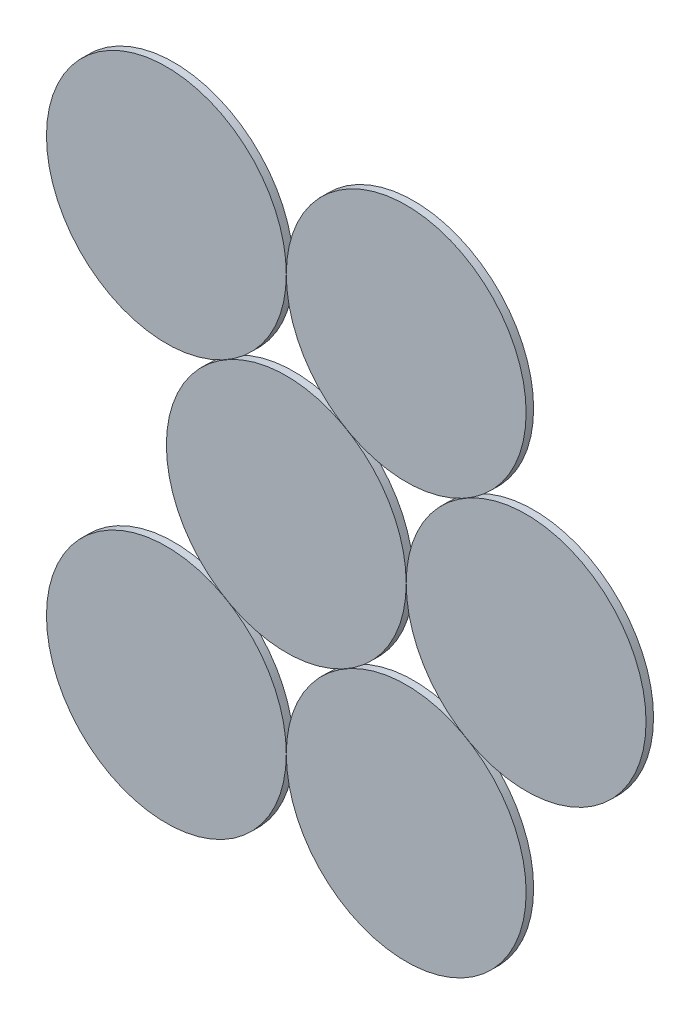
from build123d import *

# Parameters (mm, degrees)
SKETCH1_R           = 50.8
BOSS_EXTRUDE1_DEPTH = 3.175
FILL_PATTERN1_DEPTH = 3.175


# Read off the part's stored shape, not the designer's step: Fill Pattern1
with BuildPart() as part:
    # Sketch1 → Boss-Extrude1 (new body)
    with BuildSketch(Plane.XY):
        Circle(SKETCH1_R)
    extrude(amount=BOSS_EXTRUDE1_DEPTH)


with BuildPart() as body_2:
    # Fill Pattern1 outline → Fill Pattern1 (new body)
    with BuildSketch(Plane.XY):
        with BuildLine():
            ThreePointArc((127.000000809, -131.982272003), (203.2, -87.988180558), (127.000000001, -43.994090511))
            ThreePointArc((127.000000001, -43.994090511), (108.405909488, -62.588181024), (101.6, -87.988181024))
            ThreePointArc((101.6, -87.988181024), (108.405909721, -113.388181428), (127.000000809, -131.982272003))
        make_face()
        with BuildLine():
            ThreePointArc((76.2, -43.994090512), (101.6, -50.8), (127.000000001, -43.994090512))
            ThreePointArc((127.000000001, -43.994090512), (101.6, 50.8), (76.2, -43.994090512))
        make_face()
        with BuildLine():
            ThreePointArc((50.8, -175.976362049), (126.999999596, -219.970452795), (127.000000809, -131.982272004))
            ThreePointArc((127.000000809, -131.982272004), (101.600000016, -125.176362049), (76.19999922, -131.982271987))
            ThreePointArc((76.19999922, -131.982271987), (57.605909262, -150.576362439), (50.8, -175.976362049))
        make_face()
        with BuildLine():
            ThreePointArc((76.199999219, -131.982271987), (94.794090287, -113.388181414), (101.6, -87.988181024))
            ThreePointArc((101.6, -87.988181024), (94.794090512, -62.588181024), (76.2, -43.994090512))
            ThreePointArc((76.2, -43.994090512), (6.805909644, -62.588180753), (25.399999458, -131.982271224))
            ThreePointArc((25.399999458, -131.982271224), (50.799999237, -138.788181024), (76.199999219, -131.982271987))
        make_face()
        with BuildLine():
            ThreePointArc((50.8, -175.976362049), (43.994090356, -150.576361778), (25.399999458, -131.982271224))
            ThreePointArc((25.399999458, -131.982271224), (-43.994090356, -201.37636232), (50.8, -175.976362049))
        make_face()
    extrude(amount=FILL_PATTERN1_DEPTH)


solid = Compound([part.part, body_2.part])
